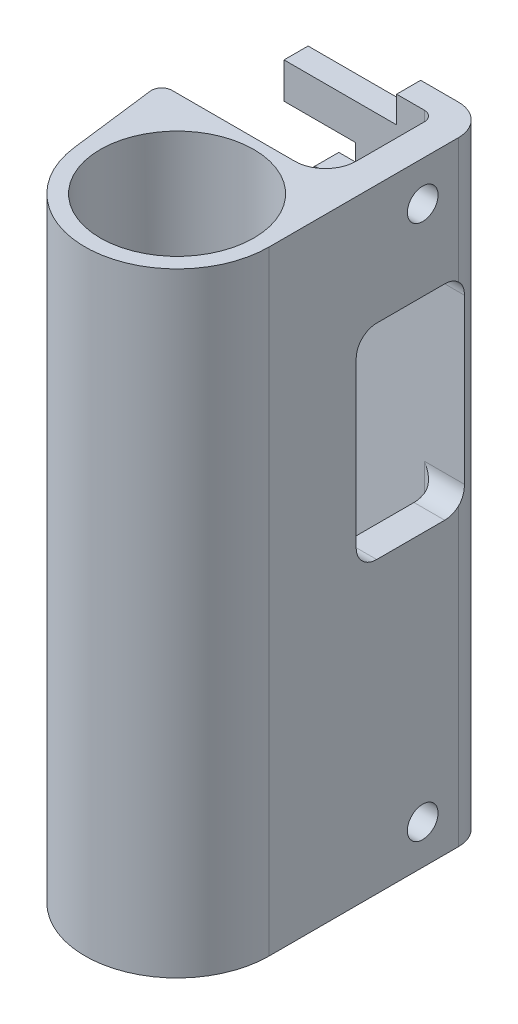
from build123d import *

# Parameters (mm, degrees)
EXTRUDE_1_DEPTH            = 11.7
EXTRUDE_2_DEPTH            = 20
SKETCH_3_W                 = 3
SKETCH_3_H                 = 2.35
EXTRUDE_3_DEPTH            = 20
EXTRUDE_4_DEPTH            = 28.3
SKETCH_5_W                 = 2.35
SKETCH_5_H                 = 60
EXTRUDE_5_DEPTH            = 14.7
CUT_EXTRUDE_1_REACH        = 70.066
SKETCH_6_W                 = 11
SKETCH_6_H                 = 2.6
CUT_EXTRUDE_2_REACH        = 70.066
CUT_EXTRUDE_3_REACH        = 70.066
HOLE_WIZARD_3_0_3_1_D      = 3
HOLE_WIZARD_3_0_3_1_DEPTH  = 19.132814283
HOLE_WIZARD_3_0_3_2_D      = 3
HOLE_WIZARD_3_0_3_2_DEPTH  = 2.35
HOLE_WIZARD_15_0_15_1_D    = 15
HOLE_WIZARD_3_0_3_3_REACH  = 65.316
HOLE_WIZARD_3_0_3_3_BORE_R = 1.5
HOLE_WIZARD_3_0_3_4_REACH  = 68.474
HOLE_WIZARD_3_0_3_4_BORE_R = 1.5
FILLET_1_R                 = 1
FILLET_2_R                 = 2
FILLET_START               = 2.9999999
FILLET_3_DEPTH             = 3.0000001
FILLET_START_2             = -60
FILLET_3_2_DEPTH           = 60


with BuildPart() as part:
    # Эскиз1 → Бобышка-Вытянуть1 (new body)
    with BuildSketch(Plane(origin=(0, 0, 0), x_dir=(1, 0, 0), z_dir=(0, 1, 0))):
        with BuildLine():
            Line((9, 21.5), (6, 21.5))
            Line((6, 21.5), (6, 8.5))
            Line((6, 8.5), (-10.132814283, 8.5))
            Line((-10.132814283, 8.5), (-8.930469533, -1.11656344))
            ThreePointArc((-8.930469533, -1.11656344), (0.55936312, -8.982600564), (9, 0))
            Line((9, 0), (9, 21.5))
        make_face()
    extrude(amount=-EXTRUDE_1_DEPTH)

    # Эскиз2 → Бобышка-Вытянуть2 (add)
    with BuildSketch(Plane.XZ.offset(11.7)):
        with BuildLine():
            Line((9, -8.5), (-10.132814283, -8.5))
            Line((-10.132814283, -8.5), (-8.930469533, 1.11656344))
            ThreePointArc((-8.930469533, 1.11656344), (0.55936312, 8.982600564), (9, 0))
            Line((9, 0), (9, -8.5))
        make_face()
    extrude(amount=EXTRUDE_2_DEPTH)

    # Эскиз3 → Бобышка-Вытянуть3 (add)
    with BuildSketch(Plane.XZ.offset(11.7)):
        with Locations((7.5, -20.325)):
            Rectangle(SKETCH_3_W, SKETCH_3_H)
    extrude(amount=EXTRUDE_3_DEPTH)

    # Эскиз4 → Бобышка-Вытянуть4 (add)
    with BuildSketch(Plane.XZ.offset(31.7)):
        with BuildLine():
            Line((6, -21.5), (6, -8.5))
            Line((6, -8.5), (-10.132814283, -8.5))
            Line((-10.132814283, -8.5), (-8.930469533, 1.11656344))
            ThreePointArc((-8.930469533, 1.11656344), (0.55936312, 8.982600564), (9, 0))
            Line((9, 0), (9, -21.5))
            Line((9, -21.5), (6, -21.5))
        make_face()
    extrude(amount=EXTRUDE_4_DEPTH)

    # Эскиз5 → Бобышка-Вытянуть5 (add)
    with BuildSketch(Plane.ZY.offset(-6)):
        with Locations((-20.325, -30)):
            Rectangle(SKETCH_5_W, SKETCH_5_H)
    extrude(amount=EXTRUDE_5_DEPTH)

    # Эскиз6 → Вырез-Вытянуть1 (cut, up to next)
    with BuildSketch(Plane(origin=(0, 0, -21.5), x_dir=(-1, 0, 0), z_dir=(0, 0, -1)), mode=Mode.PRIVATE) as cut_extrude_1_sk1:
        with Locations((3.2, -1.3)):
            Rectangle(SKETCH_6_W, SKETCH_6_H)
    cut_extrude_1_tool1 = extrude(cut_extrude_1_sk1.sketch, amount=-CUT_EXTRUDE_1_REACH, mode=Mode.PRIVATE) & part.part
    add(cut_extrude_1_tool1.solids().sort_by_distance((-3.2, -1.3, -21.5))[0], mode=Mode.SUBTRACT)

    # Эскиз7 → Вырез-Вытянуть2 (cut, up to next)
    with BuildSketch(Plane(origin=(0, 0, -21.5), x_dir=(-1, 0, 0), z_dir=(0, 0, -1)), mode=Mode.PRIVATE) as cut_extrude_2_sk1:
        Polygon((8.7, -13.1), (8.7, -6.1), (1.7, -6.1), (1.7, -10.1), (5.7, -10.1), align=None)
    cut_extrude_2_tool1 = extrude(cut_extrude_2_sk1.sketch, amount=-CUT_EXTRUDE_2_REACH, mode=Mode.PRIVATE) & part.part
    add(cut_extrude_2_tool1.solids().sort_by_distance((-5.546154, -8.515385, -21.5))[0], mode=Mode.SUBTRACT)

    # Эскиз8 → Вырез-Вытянуть3 (cut, up to next)
    with BuildSketch(Plane(origin=(0, 0, -21.5), x_dir=(-1, 0, 0), z_dir=(0, 0, -1)), mode=Mode.PRIVATE) as cut_extrude_3_sk1:
        Polygon((8.7, -44.4), (8.7, -36.9), (5.7, -39.9), (1.7, -39.9), (1.7, -41.4), (5.7, -41.4), align=None)
    cut_extrude_3_tool1 = extrude(cut_extrude_3_sk1.sketch, amount=-CUT_EXTRUDE_3_REACH, mode=Mode.PRIVATE) & part.part
    add(cut_extrude_3_tool1.solids().sort_by_distance((-6.353846, -40.65, -21.5))[0], mode=Mode.SUBTRACT)

    # Диаметр отверстия Ø3.0 (3)1
    with Locations(Plane(origin=(9, 0, 0), x_dir=(0, 0, -1), z_dir=(1, 0, 0))):
        with Locations((15, -3.85), (15, -56.15)):
            Hole(HOLE_WIZARD_3_0_3_1_D / 2, depth=HOLE_WIZARD_3_0_3_1_DEPTH)

    # Диаметр отверстия Ø3.0 (3)2
    with Locations(Plane(origin=(0, 0, -21.5), x_dir=(-1, 0, 0), z_dir=(0, 0, -1))):
        with Locations((5.392274393, -21.25)):
            Hole(HOLE_WIZARD_3_0_3_2_D / 2, depth=HOLE_WIZARD_3_0_3_2_DEPTH)

    # Диаметр отверстия Ø15.0 (15)1 (through all)
    with Locations(Plane(origin=(0, 0, 0), x_dir=(1, 0, 0), z_dir=(0, 1, 0))):
        with Locations((0, 0)):
            Hole(HOLE_WIZARD_15_0_15_1_D / 2)

    # Диаметр отверстия Ø3.0 (3)3 bore → Диаметр отверстия Ø3.0 (3)3 (cut, up to next)
    with BuildSketch(Plane(origin=(0, 0, -8.5), x_dir=(-1, 0, 0), z_dir=(0, 0, -1)), mode=Mode.PRIVATE) as hole_wizard_3_0_3_3_sk1:
        with Locations((5.392274393, -21.25)):
            Circle(HOLE_WIZARD_3_0_3_3_BORE_R)
    hole_wizard_3_0_3_3_tool1 = extrude(hole_wizard_3_0_3_3_sk1.sketch, amount=-HOLE_WIZARD_3_0_3_3_REACH, mode=Mode.PRIVATE) & part.part
    add(hole_wizard_3_0_3_3_tool1.solids().sort_by_distance((-5.392274, -21.25, -8.5))[0], mode=Mode.SUBTRACT)

    # Диаметр отверстия Ø3.0 (3)4 bore → Диаметр отверстия Ø3.0 (3)4 (cut, up to next)
    with BuildSketch(Plane.ZY.offset(9.883926163), mode=Mode.PRIVATE) as hole_wizard_3_0_3_4_sk1:
        with Locations((-5.009349323, -13)):
            Circle(HOLE_WIZARD_3_0_3_4_BORE_R)
    hole_wizard_3_0_3_4_tool1 = extrude(hole_wizard_3_0_3_4_sk1.sketch, amount=-HOLE_WIZARD_3_0_3_4_REACH, mode=Mode.PRIVATE) & part.part
    # Диаметр отверстия Ø3.0 (3)4 bore → Диаметр отверстия Ø3.0 (3)4 (cut, up to next)
    with BuildSketch(Plane.ZY.offset(9.883926163), mode=Mode.PRIVATE) as hole_wizard_3_0_3_4_sk2:
        with Locations((-5.009349323, -47)):
            Circle(HOLE_WIZARD_3_0_3_4_BORE_R)
    hole_wizard_3_0_3_4_tool2 = extrude(hole_wizard_3_0_3_4_sk2.sketch, amount=-HOLE_WIZARD_3_0_3_4_REACH, mode=Mode.PRIVATE) & part.part
    add(hole_wizard_3_0_3_4_tool1.solids().sort_by_distance((-9.883926, -13, -5.009349))[0], mode=Mode.SUBTRACT)
    add(hole_wizard_3_0_3_4_tool2.solids().sort_by_distance((-9.883926, -47, -5.009349))[0], mode=Mode.SUBTRACT)

    # Скругление1
    fillet_1_edges = [part.edges().sort_by_distance(p)[0] for p in [
        (-10.132814283, -30, -8.5),
        (6, -45.85, -19.15),
        (6, -5.85, -19.15),
    ]]
    fillet(fillet_1_edges, radius=FILLET_1_R)

    # Скругление2
    fillet_2_edges = [part.edges().sort_by_distance(p)[0] for p in [
        (7, -11.7, -19.15),
        (7.5, -31.7, -8.5),
        (7.5, -11.7, -8.5),
        (7, -31.7, -19.15),
    ]]
    fillet(fillet_2_edges, radius=FILLET_2_R)

    # Скругление3: read off the stored shape, not the designer's step
    # Скругление3 outline → Скругление3 (add)
    with BuildSketch(Plane.YZ.offset(FILLET_START)):
        with BuildLine():
            Line((-13.7, -19.15), (0, -19.15))
            Line((0, -19.15), (0, -8.5))
            Line((0, -8.5), (-13.7, -8.5))
            ThreePointArc((-13.7, -8.5), (-12.285786438, -9.085786438), (-11.7, -10.5))
            Line((-11.7, -10.5), (-11.7, -17.15))
            ThreePointArc((-11.7, -17.15), (-12.285786438, -18.564213562), (-13.7, -19.15))
        make_face()
        with BuildLine():
            Line((-60, -8.5), (-60, -19.15))
            Line((-60, -19.15), (-29.7, -19.15))
            ThreePointArc((-29.7, -19.15), (-31.114213562, -18.564213562), (-31.7, -17.15))
            Line((-31.7, -17.15), (-31.7, -10.5))
            ThreePointArc((-31.7, -10.5), (-31.114213562, -9.085786438), (-29.7, -8.5))
            Line((-29.7, -8.5), (-60, -8.5))
        make_face()
    extrude(amount=FILLET_3_DEPTH)

    # Fillet 3 2 outline → Fillet 3 2 (cut)
    with BuildSketch(Plane(origin=(0, 0, 0), x_dir=(1, 0, 0), z_dir=(0, 1, 0)).offset(FILLET_START_2)):
        with BuildLine():
            ThreePointArc((6, 21.5), (8.121320344, 20.621320344), (9, 18.5))
            Line((9, 18.5), (9, 21.5))
            Line((9, 21.5), (6, 21.5))
        make_face()
        with BuildLine():
            Line((6, 11.5), (6, 18.15))
            ThreePointArc((6, 18.15), (5.707106781, 18.857106781), (5, 19.15))
            Line((5, 19.15), (2.9999999, 19.15))
            Line((2.9999999, 19.15), (3, 8.5))
            ThreePointArc((3, 8.5), (5.121320344, 9.378679656), (6, 11.5))
        make_face()
    extrude(amount=FILLET_3_2_DEPTH, mode=Mode.SUBTRACT)


solid = part.part
